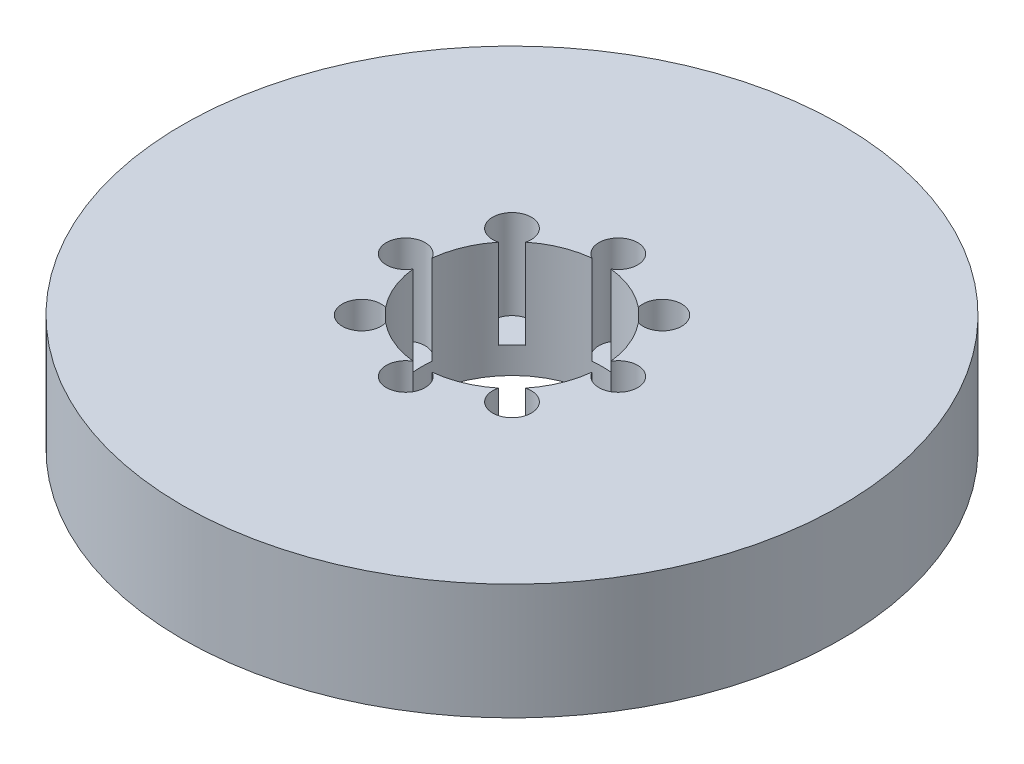
from build123d import *

# Parameters (mm, degrees)
SKETCH1_R           = 82.5
BOSS_EXTRUDE1_DEPTH = 29
SKETCH2_R           = 22.5
CUT_EXTRUDE1_DEPTH  = 121.222710001
SKETCH3_R           = 4.85010726
CUT_EXTRUDE2_DEPTH  = 22.356031406
CIRPATTERN1_COUNT   = 8


with BuildPart() as part:
    # Sketch1 → Boss-Extrude1 (new body)
    with BuildSketch(Plane(origin=(0, 0, 0), x_dir=(1, 0, 0), z_dir=(0, 1, 0))):
        Circle(SKETCH1_R)
    extrude(amount=BOSS_EXTRUDE1_DEPTH)

    # Sketch2 → Cut-Extrude1 (cut, through all)
    with BuildSketch(Plane(origin=(0, 0, 0), x_dir=(1, 0, 0), z_dir=(0, 1, 0))):
        Circle(SKETCH2_R)
    extrude(amount=CUT_EXTRUDE1_DEPTH, mode=Mode.SUBTRACT)

    # Sketch3 → Cut-Extrude2 (cut)
    with BuildSketch(Plane(origin=(0, 29, 0), x_dir=(1, 0, 0), z_dir=(0, 1, 0))):
        with Locations((-26.606378904, 0)):
            Circle(SKETCH3_R)
    cut_extrude2 = extrude(amount=-CUT_EXTRUDE2_DEPTH, mode=Mode.SUBTRACT)

    # CirPattern1: Cut-Extrude2 ×8 about axis
    cirpattern1_axis = Axis((0, 0, 0), (0, 1, 0))
    for i in range(1, CIRPATTERN1_COUNT):
        add(cut_extrude2.rotate(cirpattern1_axis, i * 360 / CIRPATTERN1_COUNT), mode=Mode.SUBTRACT)


solid = part.part
